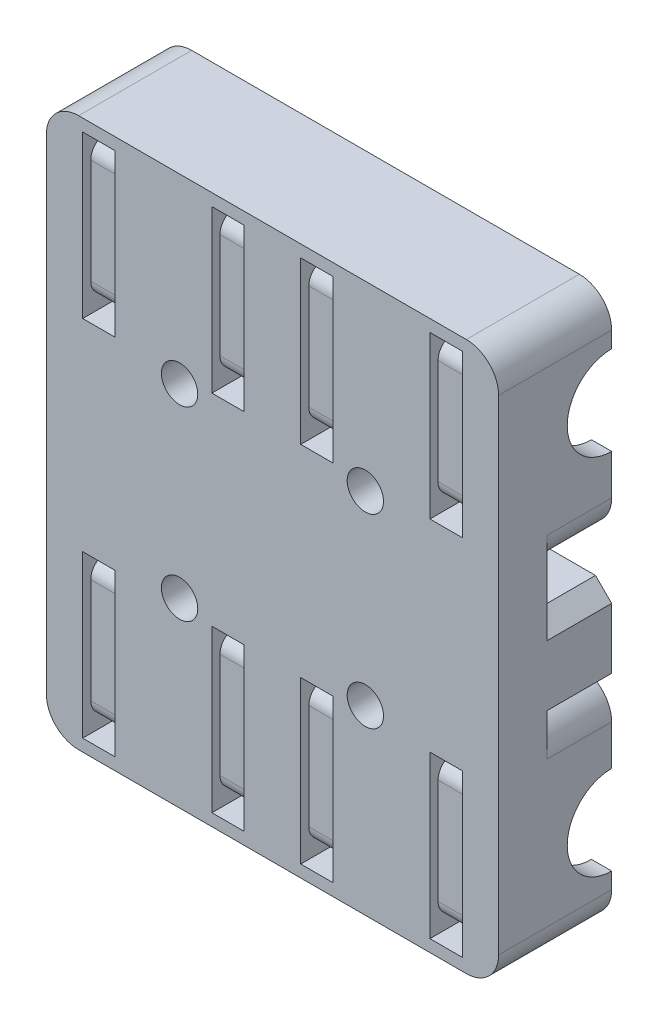
from build123d import *

# Parameters (mm, degrees)
SKETCH1_W               = 56
SKETCH1_H               = 68
BOSS_EXTRUDE1_DEPTH     = 14
SKETCH2_W               = 4
SKETCH2_H               = 1.5
SKETCH2_R               = 2.25
CUT_EXTRUDE1_DEPTH      = 90.196412484
SKETCH3_W               = 4
SKETCH3_H               = 17
CUT_EXTRUDE2_DEPTH      = 1
SKETCH5_R               = 7.5
CUT_EXTRUDE3_DEPTH      = 24.5
SKETCH7_R               = 5.5
CUT_EXTRUDE4_DEPTH      = 90.196412484
MIRROR3_COPY_1_SKETCH_R = 7.5
MIRROR3_COPY_1_DEPTH    = 24.5
FILLET1_R               = 2
CUT_EXTRUDE6_DEPTH      = 8


with BuildPart() as part:
    # Sketch1 → Boss-Extrude1 (new body)
    with BuildSketch(Plane.XY):
        with Locations((28, 34)):
            Rectangle(SKETCH1_W, SKETCH1_H)
    extrude(amount=BOSS_EXTRUDE1_DEPTH)

    # Sketch2 → Cut-Extrude1 (cut, through all)
    with BuildSketch(Plane.XY.offset(14)):
        with BuildLine():
            ThreePointArc((0, 64), (1.171572875, 66.828427125), (4, 68))
            Line((4, 68), (0, 68))
            Line((0, 68), (0, 64))
        make_face()
        with BuildLine():
            Line((56, 68), (52, 68))
            ThreePointArc((52, 68), (54.828427125, 66.828427125), (56, 64))
            Line((56, 64), (56, 68))
        make_face()
        with BuildLine():
            ThreePointArc((4, 0), (1.171572875, 1.171572875), (0, 4))
            Line((0, 4), (0, 0))
            Line((0, 0), (4, 0))
        make_face()
        with BuildLine():
            Line((56, 0), (56, 4))
            ThreePointArc((56, 4), (54.828427125, 1.171572875), (52, 0))
            Line((52, 0), (56, 0))
        make_face()
        with Locations((6.5, 47.25)):
            Rectangle(SKETCH2_W, SKETCH2_H)
        with Locations((22.5, 47.25)):
            Rectangle(SKETCH2_W, SKETCH2_H)
        with Locations((33.5, 47.25)):
            Rectangle(SKETCH2_W, SKETCH2_H)
        with Locations((49.5, 47.25)):
            Rectangle(SKETCH2_W, SKETCH2_H)
        with Locations((49.5, 65.75)):
            Rectangle(SKETCH2_W, SKETCH2_H)
        with Locations((33.5, 65.75)):
            Rectangle(SKETCH2_W, SKETCH2_H)
        with Locations((22.5, 65.75)):
            Rectangle(SKETCH2_W, SKETCH2_H)
        with Locations((6.5, 65.75)):
            Rectangle(SKETCH2_W, SKETCH2_H)
        with Locations((6.5, 20.75)):
            Rectangle(SKETCH2_W, SKETCH2_H)
        with Locations((22.5, 20.75)):
            Rectangle(SKETCH2_W, SKETCH2_H)
        with Locations((33.5, 20.75)):
            Rectangle(SKETCH2_W, SKETCH2_H)
        with Locations((49.5, 20.75)):
            Rectangle(SKETCH2_W, SKETCH2_H)
        with Locations((49.5, 2.25)):
            Rectangle(SKETCH2_W, SKETCH2_H)
        with Locations((33.5, 2.25)):
            Rectangle(SKETCH2_W, SKETCH2_H)
        with Locations((22.5, 2.25)):
            Rectangle(SKETCH2_W, SKETCH2_H)
        with Locations((6.5, 2.25)):
            Rectangle(SKETCH2_W, SKETCH2_H)
        with Locations((16.5, 22.5)):
            Circle(SKETCH2_R)
        with Locations((16.5, 45.5)):
            Circle(SKETCH2_R)
        with Locations((39.5, 45.5)):
            Circle(SKETCH2_R)
        with Locations((39.5, 22.5)):
            Circle(SKETCH2_R)
    extrude(amount=-CUT_EXTRUDE1_DEPTH, mode=Mode.SUBTRACT)

    # Sketch3 → Cut-Extrude2 (cut)
    with BuildSketch(Plane.XY.offset(14)):
        with Locations((6.5, 56.5)):
            Rectangle(SKETCH3_W, SKETCH3_H)
        with Locations((22.5, 56.5)):
            Rectangle(SKETCH3_W, SKETCH3_H)
        with Locations((33.5, 56.5)):
            Rectangle(SKETCH3_W, SKETCH3_H)
        with Locations((49.5, 56.5)):
            Rectangle(SKETCH3_W, SKETCH3_H)
        with Locations((49.5, 11.5)):
            Rectangle(SKETCH3_W, SKETCH3_H)
        with Locations((33.5, 11.5)):
            Rectangle(SKETCH3_W, SKETCH3_H)
        with Locations((22.5, 11.5)):
            Rectangle(SKETCH3_W, SKETCH3_H)
        with Locations((6.5, 11.5)):
            Rectangle(SKETCH3_W, SKETCH3_H)
    extrude(amount=-CUT_EXTRUDE2_DEPTH, mode=Mode.SUBTRACT)

    # Sketch5 → Cut-Extrude3 (cut)
    with BuildSketch(Plane(origin=(53.5, 0, 0), x_dir=(0, 0, -1), z_dir=(1, 0, 0))):
        with Locations((0, 11.5)):
            Circle(SKETCH5_R)
    cut_extrude3 = extrude(amount=-CUT_EXTRUDE3_DEPTH, mode=Mode.SUBTRACT)

    # Mirror1: Cut-Extrude3 across plane
    add(cut_extrude3.mirror(Plane(origin=(28, 0, 0), x_dir=(0, 0, 1), z_dir=(1, 0, 0))), mode=Mode.SUBTRACT)

    # Sketch7 → Cut-Extrude4 (cut, through all)
    with BuildSketch(Plane(origin=(56, 0, 0), x_dir=(0, 0, -1), z_dir=(1, 0, 0))):
        with Locations((0, 11.5)):
            Circle(SKETCH7_R)
    cut_extrude4 = extrude(amount=-CUT_EXTRUDE4_DEPTH, mode=Mode.SUBTRACT)

    # Mirror3: Cut-Extrude3, Cut-Extrude4 across plane
    add(cut_extrude3.mirror(Plane(origin=(0, 34, 0), x_dir=(0, 0, 1), z_dir=(0, -1, 0))), mode=Mode.SUBTRACT)
    add(cut_extrude4.mirror(Plane(origin=(0, 34, 0), x_dir=(0, 0, 1), z_dir=(0, -1, 0))), mode=Mode.SUBTRACT)

    # Mirror3 copy 1 sketch → Mirror3 copy 1 (cut)
    with BuildSketch(Plane(origin=(2.5, 68, 0), x_dir=(0, 0, -1), z_dir=(-1, 0, 0))):
        with Locations((0, 11.5)):
            Circle(MIRROR3_COPY_1_SKETCH_R)
    extrude(amount=-MIRROR3_COPY_1_DEPTH, mode=Mode.SUBTRACT)

    # Fillet1
    fillet1_edges = [part.edges().sort_by_distance(p)[0] for p in [
        (49.5, 3, 13),
        (33.5, 3, 13),
        (22.5, 3, 13),
        (6.5, 3, 13),
        (6.5, 20, 13),
        (22.5, 20, 13),
        (33.5, 20, 13),
        (49.5, 20, 13),
        (6.5, 48, 13),
        (6.5, 65, 13),
        (22.5, 65, 13),
        (22.5, 48, 13),
        (33.5, 48, 13),
        (33.5, 65, 13),
        (49.5, 65, 13),
        (49.5, 48, 13),
    ]]
    fillet(fillet1_edges, radius=FILLET1_R)

    # Sketch9 → Cut-Extrude6 (cut)
    with BuildSketch(Plane(origin=(0, 0, 0), x_dir=(-1, 0, 0), z_dir=(0, 0, -1))):
        with BuildLine():
            Line((-52.242222222, 27.335469288), (-52.431111111, 27.701967566))
            ThreePointArc((-52.431111111, 27.701967566), (-52.92, 28), (-53.408888889, 27.701967566))
            Line((-53.408888889, 27.701967566), (-53.597777778, 27.335469288))
            ThreePointArc((-53.597777778, 27.335469288), (-53.689870599, 27.236537266), (-53.82, 27.2))
            Line((-53.82, 27.2), (-54.01, 27.2))
            ThreePointArc((-54.01, 27.2), (-54.140129401, 27.236537266), (-54.232222222, 27.335469288))
            Line((-54.232222222, 27.335469288), (-54.421111111, 27.701967566))
            ThreePointArc((-54.421111111, 27.701967566), (-54.91, 28), (-55.398888889, 27.701967566))
            Line((-55.398888889, 27.701967566), (-55.587777778, 27.335469288))
            ThreePointArc((-55.587777778, 27.335469288), (-55.679870599, 27.236537266), (-55.81, 27.2))
            Line((-55.81, 27.2), (-56, 27.2))
            Line((-56, 27.2), (-56, 22))
            ThreePointArc((-56, 22), (-54.828427125, 24.828427125), (-52, 26))
            Line((-52, 26), (-4, 26))
            ThreePointArc((-4, 26), (-1.171572875, 24.828427125), (0, 22))
            Line((0, 22), (0, 27.2))
            Line((0, 27.2), (-0.19, 27.2))
            ThreePointArc((-0.19, 27.2), (-0.320129401, 27.236537266), (-0.412222222, 27.335469288))
            Line((-0.412222222, 27.335469288), (-0.601111111, 27.701967566))
            ThreePointArc((-0.601111111, 27.701967566), (-1.09, 28), (-1.578888889, 27.701967566))
            Line((-1.578888889, 27.701967566), (-1.767777778, 27.335469288))
            ThreePointArc((-1.767777778, 27.335469288), (-1.859870599, 27.236537266), (-1.99, 27.2))
            Line((-1.99, 27.2), (-2.18, 27.2))
            ThreePointArc((-2.18, 27.2), (-2.310129401, 27.236537266), (-2.402222222, 27.335469288))
            Line((-2.402222222, 27.335469288), (-2.591111111, 27.701967566))
            ThreePointArc((-2.591111111, 27.701967566), (-3.08, 28), (-3.568888889, 27.701967566))
            Line((-3.568888889, 27.701967566), (-3.757777778, 27.335469288))
            ThreePointArc((-3.757777778, 27.335469288), (-3.849870599, 27.236537266), (-3.98, 27.2))
            Line((-3.98, 27.2), (-4.17, 27.2))
            ThreePointArc((-4.17, 27.2), (-4.300129401, 27.236537266), (-4.392222222, 27.335469288))
            Line((-4.392222222, 27.335469288), (-4.581111111, 27.701967566))
            ThreePointArc((-4.581111111, 27.701967566), (-5.07, 28), (-5.558888889, 27.701967566))
            Line((-5.558888889, 27.701967566), (-5.747777778, 27.335469288))
            ThreePointArc((-5.747777778, 27.335469288), (-5.839870599, 27.236537266), (-5.97, 27.2))
            Line((-5.97, 27.2), (-6.16, 27.2))
            ThreePointArc((-6.16, 27.2), (-6.290129401, 27.236537266), (-6.382222222, 27.335469288))
            Line((-6.382222222, 27.335469288), (-6.571111111, 27.701967566))
            ThreePointArc((-6.571111111, 27.701967566), (-7.06, 28), (-7.548888889, 27.701967566))
            Line((-7.548888889, 27.701967566), (-7.737777778, 27.335469288))
            ThreePointArc((-7.737777778, 27.335469288), (-7.829870599, 27.236537266), (-7.96, 27.2))
            Line((-7.96, 27.2), (-8.15, 27.2))
            ThreePointArc((-8.15, 27.2), (-8.280129401, 27.236537266), (-8.372222222, 27.335469288))
            Line((-8.372222222, 27.335469288), (-8.561111111, 27.701967566))
            ThreePointArc((-8.561111111, 27.701967566), (-9.05, 28), (-9.538888889, 27.701967566))
            Line((-9.538888889, 27.701967566), (-9.727777778, 27.335469288))
            ThreePointArc((-9.727777778, 27.335469288), (-9.819870599, 27.236537266), (-9.95, 27.2))
            Line((-9.95, 27.2), (-10.14, 27.2))
            ThreePointArc((-10.14, 27.2), (-10.270129401, 27.236537266), (-10.362222222, 27.335469288))
            Line((-10.362222222, 27.335469288), (-10.551111111, 27.701967566))
            ThreePointArc((-10.551111111, 27.701967566), (-11.04, 28), (-11.528888889, 27.701967566))
            Line((-11.528888889, 27.701967566), (-11.717777778, 27.335469288))
            ThreePointArc((-11.717777778, 27.335469288), (-11.809870599, 27.236537266), (-11.94, 27.2))
            Line((-11.94, 27.2), (-12.13, 27.2))
            ThreePointArc((-12.13, 27.2), (-12.260129401, 27.236537266), (-12.352222222, 27.335469288))
            Line((-12.352222222, 27.335469288), (-12.541111111, 27.701967566))
            ThreePointArc((-12.541111111, 27.701967566), (-13.03, 28), (-13.518888889, 27.701967566))
            Line((-13.518888889, 27.701967566), (-13.707777778, 27.335469288))
            ThreePointArc((-13.707777778, 27.335469288), (-13.799870599, 27.236537266), (-13.93, 27.2))
            Line((-13.93, 27.2), (-14.12, 27.2))
            ThreePointArc((-14.12, 27.2), (-14.250129401, 27.236537266), (-14.342222222, 27.335469288))
            Line((-14.342222222, 27.335469288), (-14.531111111, 27.701967566))
            ThreePointArc((-14.531111111, 27.701967566), (-15.02, 28), (-15.508888889, 27.701967566))
            Line((-15.508888889, 27.701967566), (-15.697777778, 27.335469288))
            ThreePointArc((-15.697777778, 27.335469288), (-15.789870599, 27.236537266), (-15.92, 27.2))
            Line((-15.92, 27.2), (-16.11, 27.2))
            ThreePointArc((-16.11, 27.2), (-16.240129401, 27.236537266), (-16.332222222, 27.335469288))
            Line((-16.332222222, 27.335469288), (-16.521111111, 27.701967566))
            ThreePointArc((-16.521111111, 27.701967566), (-17.01, 28), (-17.498888889, 27.701967566))
            Line((-17.498888889, 27.701967566), (-17.687777778, 27.335469288))
            ThreePointArc((-17.687777778, 27.335469288), (-17.779870599, 27.236537266), (-17.91, 27.2))
            Line((-17.91, 27.2), (-18.1, 27.2))
            ThreePointArc((-18.1, 27.2), (-18.230129401, 27.236537266), (-18.322222222, 27.335469288))
            Line((-18.322222222, 27.335469288), (-18.511111111, 27.701967566))
            ThreePointArc((-18.511111111, 27.701967566), (-19, 28), (-19.488888889, 27.701967566))
            Line((-19.488888889, 27.701967566), (-19.677777778, 27.335469288))
            ThreePointArc((-19.677777778, 27.335469288), (-19.769870599, 27.236537266), (-19.9, 27.2))
            Line((-19.9, 27.2), (-20.09, 27.2))
            ThreePointArc((-20.09, 27.2), (-20.220129401, 27.236537266), (-20.312222222, 27.335469288))
            Line((-20.312222222, 27.335469288), (-20.501111111, 27.701967566))
            ThreePointArc((-20.501111111, 27.701967566), (-20.99, 28), (-21.478888889, 27.701967566))
            Line((-21.478888889, 27.701967566), (-21.667777778, 27.335469288))
            ThreePointArc((-21.667777778, 27.335469288), (-21.759870599, 27.236537266), (-21.89, 27.2))
            Line((-21.89, 27.2), (-21.89, 34.7))
            Line((-21.89, 34.7), (-19.89, 36.7))
            Line((-19.89, 36.7), (-2, 36.7))
            Line((-2, 36.7), (0, 34.7))
            Line((0, 34.7), (0, 46))
            ThreePointArc((0, 46), (-1.171572875, 43.171572875), (-4, 42))
            Line((-4, 42), (-52, 42))
            ThreePointArc((-52, 42), (-54.828427125, 43.171572875), (-56, 46))
            Line((-56, 46), (-56, 34.7))
            Line((-56, 34.7), (-54, 36.7))
            Line((-54, 36.7), (-36.11, 36.7))
            Line((-36.11, 36.7), (-34.11, 34.7))
            Line((-34.11, 34.7), (-34.11, 27.2))
            ThreePointArc((-34.11, 27.2), (-34.240129401, 27.236537266), (-34.332222222, 27.335469288))
            Line((-34.332222222, 27.335469288), (-34.521111111, 27.701967566))
            ThreePointArc((-34.521111111, 27.701967566), (-35.01, 28), (-35.498888889, 27.701967566))
            Line((-35.498888889, 27.701967566), (-35.687777778, 27.335469288))
            ThreePointArc((-35.687777778, 27.335469288), (-35.779870599, 27.236537266), (-35.91, 27.2))
            Line((-35.91, 27.2), (-36.1, 27.2))
            ThreePointArc((-36.1, 27.2), (-36.230129401, 27.236537266), (-36.322222222, 27.335469288))
            Line((-36.322222222, 27.335469288), (-36.511111111, 27.701967566))
            ThreePointArc((-36.511111111, 27.701967566), (-37, 28), (-37.488888889, 27.701967566))
            Line((-37.488888889, 27.701967566), (-37.677777778, 27.335469288))
            ThreePointArc((-37.677777778, 27.335469288), (-37.769870599, 27.236537266), (-37.9, 27.2))
            Line((-37.9, 27.2), (-38.09, 27.2))
            ThreePointArc((-38.09, 27.2), (-38.220129401, 27.236537266), (-38.312222222, 27.335469288))
            Line((-38.312222222, 27.335469288), (-38.501111111, 27.701967566))
            ThreePointArc((-38.501111111, 27.701967566), (-38.99, 28), (-39.478888889, 27.701967566))
            Line((-39.478888889, 27.701967566), (-39.667777778, 27.335469288))
            ThreePointArc((-39.667777778, 27.335469288), (-39.759870599, 27.236537266), (-39.89, 27.2))
            Line((-39.89, 27.2), (-40.08, 27.2))
            ThreePointArc((-40.08, 27.2), (-40.210129401, 27.236537266), (-40.302222222, 27.335469288))
            Line((-40.302222222, 27.335469288), (-40.491111111, 27.701967566))
            ThreePointArc((-40.491111111, 27.701967566), (-40.98, 28), (-41.468888889, 27.701967566))
            Line((-41.468888889, 27.701967566), (-41.657777778, 27.335469288))
            ThreePointArc((-41.657777778, 27.335469288), (-41.749870599, 27.236537266), (-41.88, 27.2))
            Line((-41.88, 27.2), (-42.07, 27.2))
            ThreePointArc((-42.07, 27.2), (-42.200129401, 27.236537266), (-42.292222222, 27.335469288))
            Line((-42.292222222, 27.335469288), (-42.481111111, 27.701967566))
            ThreePointArc((-42.481111111, 27.701967566), (-42.97, 28), (-43.458888889, 27.701967566))
            Line((-43.458888889, 27.701967566), (-43.647777778, 27.335469288))
            ThreePointArc((-43.647777778, 27.335469288), (-43.739870599, 27.236537266), (-43.87, 27.2))
            Line((-43.87, 27.2), (-44.06, 27.2))
            ThreePointArc((-44.06, 27.2), (-44.190129401, 27.236537266), (-44.282222222, 27.335469288))
            Line((-44.282222222, 27.335469288), (-44.471111111, 27.701967566))
            ThreePointArc((-44.471111111, 27.701967566), (-44.96, 28), (-45.448888889, 27.701967566))
            Line((-45.448888889, 27.701967566), (-45.637777778, 27.335469288))
            ThreePointArc((-45.637777778, 27.335469288), (-45.729870599, 27.236537266), (-45.86, 27.2))
            Line((-45.86, 27.2), (-46.05, 27.2))
            ThreePointArc((-46.05, 27.2), (-46.180129401, 27.236537266), (-46.272222222, 27.335469288))
            Line((-46.272222222, 27.335469288), (-46.461111111, 27.701967566))
            ThreePointArc((-46.461111111, 27.701967566), (-46.95, 28), (-47.438888889, 27.701967566))
            Line((-47.438888889, 27.701967566), (-47.627777778, 27.335469288))
            ThreePointArc((-47.627777778, 27.335469288), (-47.719870599, 27.236537266), (-47.85, 27.2))
            Line((-47.85, 27.2), (-48.04, 27.2))
            ThreePointArc((-48.04, 27.2), (-48.170129401, 27.236537266), (-48.262222222, 27.335469288))
            Line((-48.262222222, 27.335469288), (-48.451111111, 27.701967566))
            ThreePointArc((-48.451111111, 27.701967566), (-48.94, 28), (-49.428888889, 27.701967566))
            Line((-49.428888889, 27.701967566), (-49.617777778, 27.335469288))
            ThreePointArc((-49.617777778, 27.335469288), (-49.709870599, 27.236537266), (-49.84, 27.2))
            Line((-49.84, 27.2), (-50.03, 27.2))
            ThreePointArc((-50.03, 27.2), (-50.160129401, 27.236537266), (-50.252222222, 27.335469288))
            Line((-50.252222222, 27.335469288), (-50.441111111, 27.701967566))
            ThreePointArc((-50.441111111, 27.701967566), (-50.93, 28), (-51.418888889, 27.701967566))
            Line((-51.418888889, 27.701967566), (-51.607777778, 27.335469288))
            ThreePointArc((-51.607777778, 27.335469288), (-51.699870599, 27.236537266), (-51.83, 27.2))
            Line((-51.83, 27.2), (-52.02, 27.2))
            ThreePointArc((-52.02, 27.2), (-52.150129401, 27.236537266), (-52.242222222, 27.335469288))
        make_face()
    extrude(amount=-CUT_EXTRUDE6_DEPTH, mode=Mode.SUBTRACT)


solid = part.part
